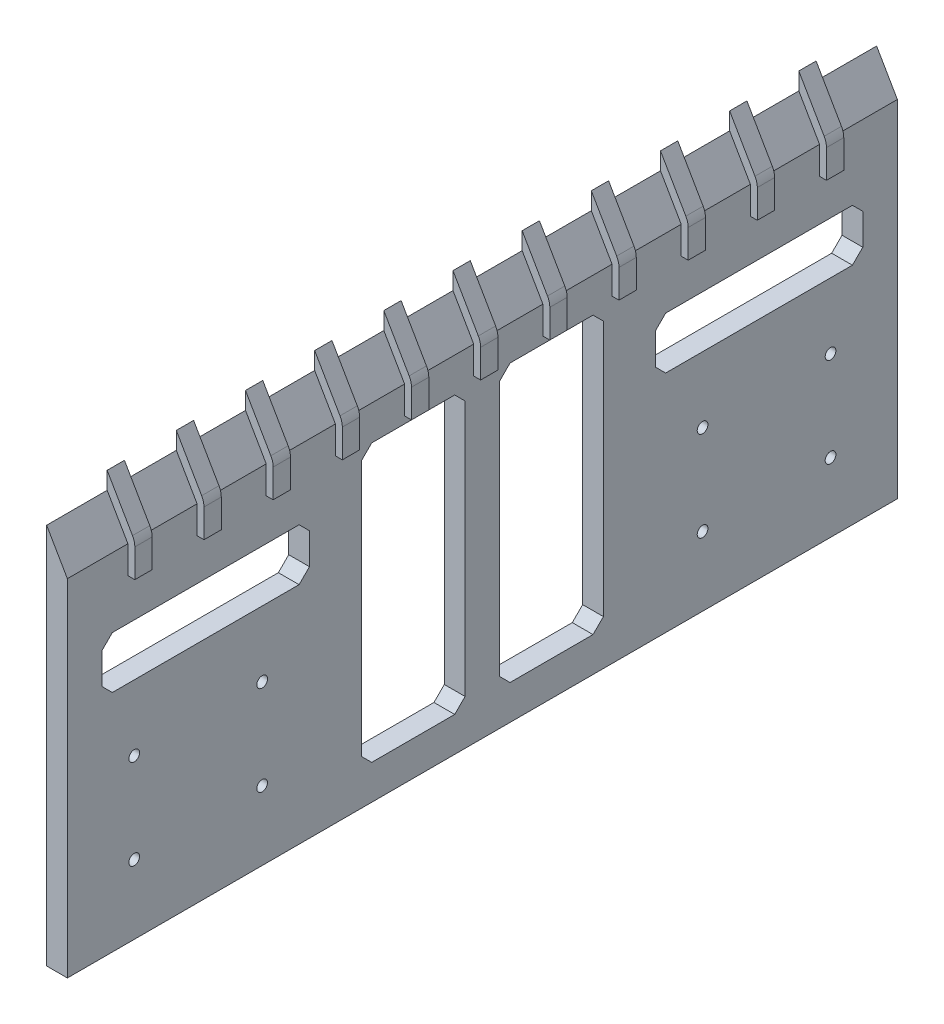
from build123d import *

# Parameters (mm, degrees)
SKETCH_1_W                  = 240
SKETCH_1_H                  = 100
EXTRUDE_1_DEPTH             = 6
SKETCH_2_R                  = 1.55
CUT_EXTRUDE_1_DEPTH         = 261.069221555
SKETCH_3_W                  = 60
SKETCH_3_H                  = 15
CUT_EXTRUDE_2_DEPTH         = 261.069221555
SKETCH_4_W                  = 30
SKETCH_4_H                  = 80
CUT_EXTRUDE_3_DEPTH         = 261.069221555
SKETCH_5_R                  = 3
CUT_EXTRUDE_4_DEPTH         = 3
EXTRUDE_2_DEPTH             = 240
EXTRUDE_3_DEPTH             = 5
PATTERN_LINEAR_5_COUNT      = 6
PATTERN_LINEAR_5_PITCH      = 20
PATTERN_LINEAR_5_COUNT_DIR2 = 6
PATTERN_LINEAR_5_PITCH_DIR2 = 20
FILLET_5_R                  = 5
CHAMFER_1_SIZE              = 3


with BuildPart() as part:
    # 草图1 → 凸台-拉伸1 (new body)
    with BuildSketch(Plane(origin=(0, 0, 0), x_dir=(0, 0, -1), z_dir=(1, 0, 0))):
        with Locations((120, -50)):
            Rectangle(SKETCH_1_W, SKETCH_1_H)
    extrude(amount=EXTRUDE_1_DEPTH)

    # 草图2 → 切除-拉伸1 (cut, through all)
    with BuildSketch(Plane(origin=(6, 0, 0), x_dir=(0, 0, -1), z_dir=(1, 0, 0))):
        with Locations((19.32352941, -54)):
            Circle(SKETCH_2_R)
        with Locations((56.32352941, -80)):
            Circle(SKETCH_2_R)
        with Locations((56.32352941, -54)):
            Circle(SKETCH_2_R)
        with Locations((19.32352941, -80)):
            Circle(SKETCH_2_R)
        with Locations((220.67647059, -80)):
            Circle(SKETCH_2_R)
        with Locations((183.67647059, -54)):
            Circle(SKETCH_2_R)
        with Locations((183.67647059, -80)):
            Circle(SKETCH_2_R)
        with Locations((220.67647059, -54)):
            Circle(SKETCH_2_R)
    extrude(amount=-CUT_EXTRUDE_1_DEPTH, mode=Mode.SUBTRACT)

    # 草图3 → 切除-拉伸2 (cut, through all)
    with BuildSketch(Plane(origin=(6, 0, 0), x_dir=(0, 0, -1), z_dir=(1, 0, 0))):
        with Locations((40, -27.5)):
            Rectangle(SKETCH_3_W, SKETCH_3_H)
        with Locations((200, -27.5)):
            Rectangle(SKETCH_3_W, SKETCH_3_H)
    extrude(amount=-CUT_EXTRUDE_2_DEPTH, mode=Mode.SUBTRACT)

    # 草图4 → 切除-拉伸3 (cut, through all)
    with BuildSketch(Plane(origin=(6, 0, 0), x_dir=(0, 0, -1), z_dir=(1, 0, 0))):
        with Locations((100, -50)):
            Rectangle(SKETCH_4_W, SKETCH_4_H)
        with Locations((140, -50)):
            Rectangle(SKETCH_4_W, SKETCH_4_H)
    extrude(amount=-CUT_EXTRUDE_3_DEPTH, mode=Mode.SUBTRACT)

    # 草图5 → 切除-拉伸4 (cut)
    with BuildSketch(Plane.ZY):
        with Locations((-183.67647059, -80)):
            Circle(SKETCH_5_R)
        with Locations((-220.67647059, -80)):
            Circle(SKETCH_5_R)
        with Locations((-183.67647059, -54)):
            Circle(SKETCH_5_R)
        with Locations((-220.67647059, -54)):
            Circle(SKETCH_5_R)
        with Locations((-45, -80)):
            Circle(SKETCH_5_R)
        with Locations((-19.32352941, -80)):
            Circle(SKETCH_5_R)
        with Locations((-19.32352941, -54)):
            Circle(SKETCH_5_R)
        with Locations((-56.32352941, -54)):
            Circle(SKETCH_5_R)
    extrude(amount=-CUT_EXTRUDE_4_DEPTH, mode=Mode.SUBTRACT)

    # 草图6 → 凸台-拉伸2 (add)
    with BuildSketch(Plane.XY):
        Polygon((6, 0), (0, 0), (0, 10.392304845), align=None)
    extrude(amount=-EXTRUDE_2_DEPTH)

    # 草图7 → 凸台-拉伸3 (add)
    with BuildSketch(Plane.XY.offset(-117.5)):
        Polygon((0, 10.392304845), (0, 15.392304845), (8, 1.535898385), (8, -8), (6, -8), (6, 0), align=None)
    extrude_3 = extrude(amount=-EXTRUDE_3_DEPTH)

    # 阵列(线性)5: Extrude 3 6 × 6
    with Locations(*[Vector(0, 0, 1) * (i * PATTERN_LINEAR_5_PITCH) + Vector(0, 0, -1) * (j * PATTERN_LINEAR_5_PITCH_DIR2) for i in range(PATTERN_LINEAR_5_COUNT) for j in range(PATTERN_LINEAR_5_COUNT_DIR2) if (i, j) != (0, 0)]):
        add(extrude_3)

    # 圆角5
    fillet_5_edges = [part.edges().sort_by_distance(p)[0] for p in [
        (8, 1.535898385, -20),
        (8, 1.535898385, -40),
        (8, 1.535898385, -60),
        (8, 1.535898385, -80),
        (8, 1.535898385, -100),
        (8, 1.535898385, -120),
        (8, 1.535898385, -140),
        (8, 1.535898385, -160),
        (8, 1.535898385, -180),
        (8, 1.535898385, -200),
        (8, 1.535898385, -220),
    ]]
    fillet(fillet_5_edges, radius=FILLET_5_R)

    # 倒角1
    chamfer_1_edges = [part.edges().sort_by_distance(p)[0] for p in [
        (3, -90, -85),
        (3, -90, -125),
        (3, -35, -170),
        (3, -35, -230),
        (3, -90, -155),
        (3, -90, -115),
        (3, -20, -230),
        (3, -10, -155),
        (3, -10, -115),
        (3, -20, -170),
        (3, -10, -125),
        (3, -10, -85),
        (3, -35, -70),
        (3, -20, -70),
        (3, -35, -10),
        (3, -20, -10),
    ]]
    chamfer(chamfer_1_edges, length=CHAMFER_1_SIZE)


solid = part.part
